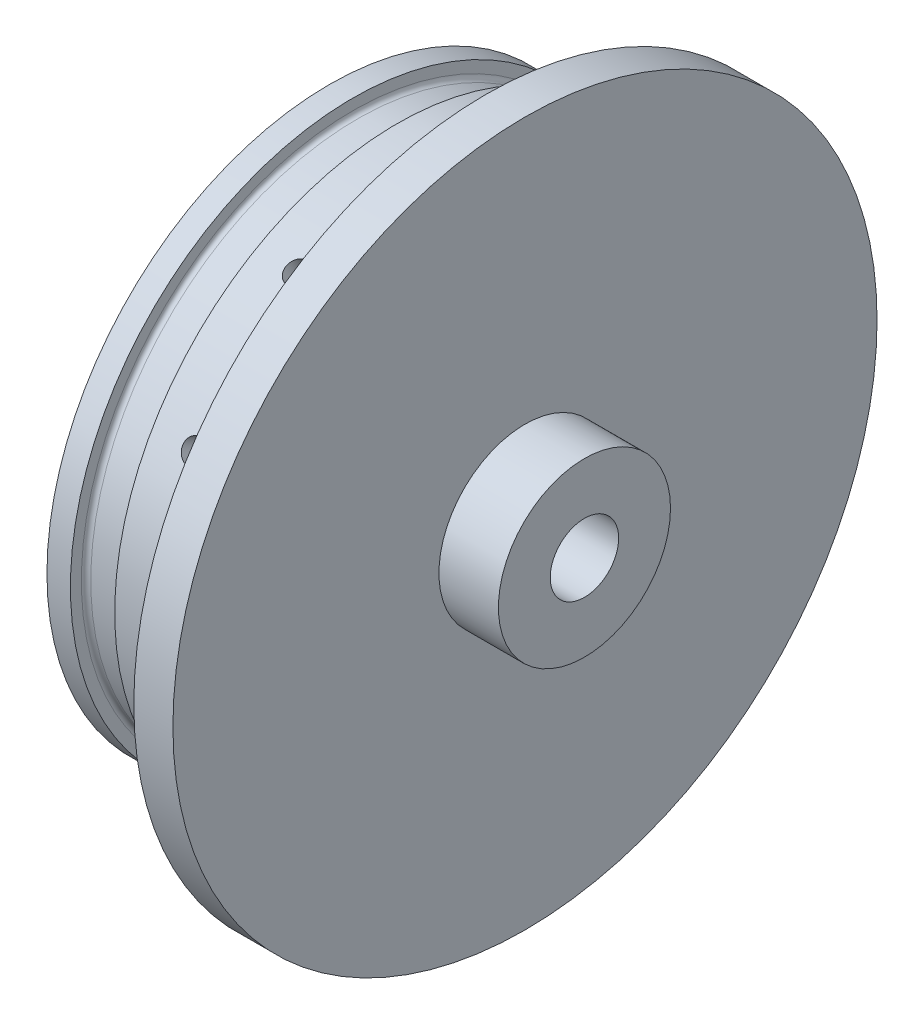
from build123d import *

# Parameters (mm, degrees)
SKETCH1_R               = 57.15
BOSS_EXTRUDE1_DEPTH     = 6.35
SKETCH2_R               = 45.847
BOSS_EXTRUDE2_DEPTH     = 25.4
SKETCH11_R              = 1.89865
CUT_EXTRUDE3_DEPTH      = 10.16
CIRPATTERN1_COUNT       = 12
CUT_EXTRUDE4_DEPTH      = 87.83494404
CUT_EXTRUDE4_DEPTH_BACK = 87.83494404
SKETCH15_R              = 5.55625
BOSS_EXTRUDE3_START     = 9.652
SKETCH17_R              = 13.97
SKETCH17_R_2            = 5.55625
BOSS_EXTRUDE3_DEPTH     = 9.652
SKETCH18_R              = 38.1
CUT_EXTRUDE5_DEPTH      = 6.604
SKETCH19_R              = 1.1303
CUT_EXTRUDE6_DEPTH      = 6.35
SKETCH20_R              = 23.495
CUT_EXTRUDE7_DEPTH      = 19.05
FILLET1_R               = 2.54
CHAMFER1_SIZE           = 5.08


with BuildPart() as part:
    # Sketch1 → Boss-Extrude1 (new body)
    with BuildSketch(Plane(origin=(0, 0, 0), x_dir=(0, 0, -1), z_dir=(1, 0, 0))):
        Circle(SKETCH1_R)
    extrude(amount=BOSS_EXTRUDE1_DEPTH)

    # Sketch2 → Boss-Extrude2 (add)
    with BuildSketch(Plane.ZY):
        Circle(SKETCH2_R)
    extrude(amount=BOSS_EXTRUDE2_DEPTH)

    # Sketch11 → Cut-Extrude3 (cut)
    with BuildSketch(Plane(origin=(0, 0, -45.847), x_dir=(-1, 0, 0), z_dir=(0, 0, -1))):
        with Locations((7.62, 0)):
            Circle(SKETCH11_R)
    cut_extrude3 = extrude(amount=-CUT_EXTRUDE3_DEPTH, mode=Mode.SUBTRACT)

    # CirPattern1: Cut-Extrude3 ×12 about axis
    cirpattern1_axis = Axis((0, 0, 0), (-1, 0, 0))
    for i in range(1, CIRPATTERN1_COUNT):
        add(cut_extrude3.rotate(cirpattern1_axis, i * 360 / CIRPATTERN1_COUNT), mode=Mode.SUBTRACT)

    # Sketch15 → Cut-Extrude4 (cut, two sides: drawn at the far end of the back side and taken through both)
    with BuildSketch(Plane(origin=(6.35, 0, 0), x_dir=(0, 0, -1), z_dir=(1, 0, 0)).offset(-CUT_EXTRUDE4_DEPTH_BACK)):
        Circle(SKETCH15_R)
    extrude(amount=CUT_EXTRUDE4_DEPTH + CUT_EXTRUDE4_DEPTH_BACK, mode=Mode.SUBTRACT)

    # Sketch16 → Cut-Revolve1 (revolve, cut)
    with BuildSketch(Plane.XY):
        with BuildLine():
            Line((-21.59, 45.847), (-14.4018, 45.847))
            Line((-14.4018, 45.847), (-14.4018, 44.069))
            ThreePointArc((-14.4018, 44.069), (-14.624984633, 43.530184633), (-15.1638, 43.307))
            Line((-15.1638, 43.307), (-20.828, 43.307))
            ThreePointArc((-20.828, 43.307), (-21.366815367, 43.530184633), (-21.59, 44.069))
            Line((-21.59, 44.069), (-21.59, 45.847))
        make_face()
    revolve(axis=Axis((0, 0, 0), (-1, 0, 0)), mode=Mode.SUBTRACT)

    # Sketch17 → Boss-Extrude3 (add)
    with BuildSketch(Plane(origin=(6.35, 0, 0), x_dir=(0, 0, -1), z_dir=(1, 0, 0)).offset(BOSS_EXTRUDE3_START)):
        Circle(SKETCH17_R)
        Circle(SKETCH17_R_2, mode=Mode.SUBTRACT)
    extrude(amount=-BOSS_EXTRUDE3_DEPTH)

    # Sketch18 → Cut-Extrude5 (cut)
    with BuildSketch(Plane.ZY.offset(25.4)):
        Circle(SKETCH18_R)
    extrude(amount=-CUT_EXTRUDE5_DEPTH, mode=Mode.SUBTRACT)

    # Sketch19 → Cut-Extrude6 (cut)
    with BuildSketch(Plane.ZY.offset(18.796)):
        with Locations((0, 33.274)):
            Circle(SKETCH19_R)
        with Locations((23.528271037, 23.528271037)):
            Circle(SKETCH19_R)
        with Locations((33.274, 0)):
            Circle(SKETCH19_R)
        with Locations((23.528271037, -23.528271037)):
            Circle(SKETCH19_R)
        with Locations((0, -33.274)):
            Circle(SKETCH19_R)
        with Locations((-23.528271037, -23.528271037)):
            Circle(SKETCH19_R)
        with Locations((-33.274, 0)):
            Circle(SKETCH19_R)
        with Locations((-23.528271037, 23.528271037)):
            Circle(SKETCH19_R)
    extrude(amount=-CUT_EXTRUDE6_DEPTH, mode=Mode.SUBTRACT)

    # Sketch20 → Cut-Extrude7 (cut)
    with BuildSketch(Plane.ZY.offset(18.796)):
        Circle(SKETCH20_R)
    extrude(amount=-CUT_EXTRUDE7_DEPTH, mode=Mode.SUBTRACT)

    # Fillet1
    fillet1_edges = [part.edges().sort_by_distance(p)[0] for p in [
        (0.254, 0, -23.495),
    ]]
    fillet(fillet1_edges, radius=FILLET1_R)

    # Chamfer1
    chamfer1_edges = [part.edges().sort_by_distance(p)[0] for p in [
        (0.254, 0, 5.55625),
    ]]
    chamfer(chamfer1_edges, length=CHAMFER1_SIZE)


solid = part.part
